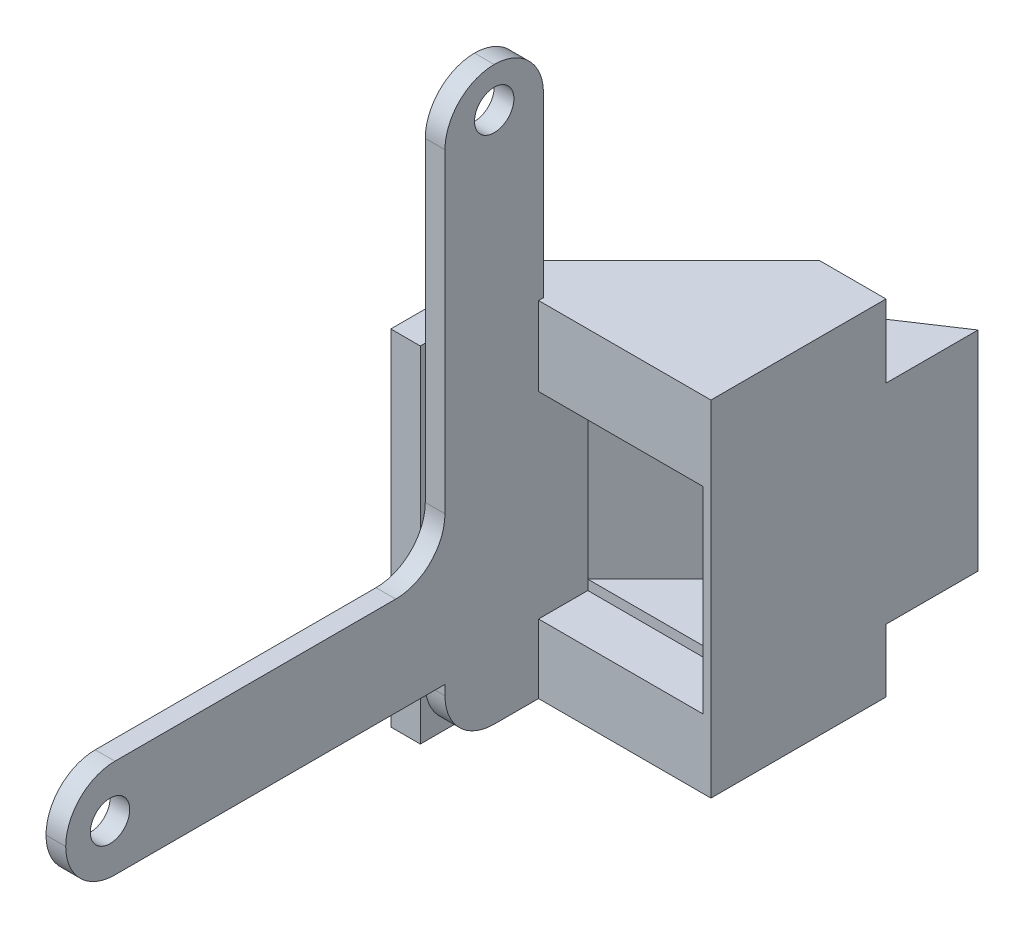
from build123d import *

# Parameters (mm, degrees)
SKETCH_1_W               = 2
SKETCH_1_H               = 58
EXTRUDE_1_DEPTH          = 53
SKETCH_4_W               = 5
SKETCH_4_H               = 35
EXTRUDE_3_DEPTH          = 19.5
CUT_EXTRUDE_START        = -0.8
SKETCH_9_W               = 5
SKETCH_9_H               = 20
CUT_EXTRUDE_5_DEPTH      = 16.7
SKETCH_10_R              = 2
CUT_EXTRUDE_6_DEPTH      = 10
SKETCH_11_W              = 38.5
SKETCH_11_H              = 6
SKETCH_11_H_2            = 42
SKETCH_11_W_2            = 4.5
SKETCH_11_H_3            = 23
CUT_EXTRUDE_7_DEPTH      = 10
FILLET_1_R               = 5
EXTRUDE_4_DEPTH          = 35
EXTRUDE_5_DEPTH          = 35
CUT_EXTRUDE_START_2      = 5
SKETCH_14_W              = 17.67500243
SKETCH_14_H              = 173.36044852
CUT_EXTRUDE_9_DEPTH      = 12
CUT_EXTRUDE_START_3      = 19
CUT_EXTRUDE_10_DEPTH     = 18
SKETCH_16_W              = 19.32347426
SKETCH_16_H              = 7.4
SKETCH_16_W_2            = 22.441906264
SKETCH_16_H_2            = 6.4
CUT_EXTRUDE_11_DEPTH     = 10
CUT_EXTRUDE_8_DEPTH      = 20
CUT_EXTRUDE_8_DEPTH_BACK = 43


with BuildPart() as part:
    # Эскиз1 → Бобышка-Вытянуть1 (new body)
    with BuildSketch(Plane.XY):
        with Locations((1, -29)):
            Rectangle(SKETCH_1_W, SKETCH_1_H)
    extrude(amount=EXTRUDE_1_DEPTH)

    # Эскиз4 → Бобышка-Вытянуть3 (add)
    with BuildSketch(Plane.ZY):
        with Locations((2.5, -40.5)):
            Rectangle(SKETCH_4_W, SKETCH_4_H)
    extrude(amount=-EXTRUDE_3_DEPTH)

    # Эскиз9 → Вырез-Вытянуть5 (cut)
    with BuildSketch(Plane(origin=(19.5, 0, 0), x_dir=(0, 0, -1), z_dir=(1, 0, 0)).offset(CUT_EXTRUDE_START)):
        with Locations((-2.5, -41)):
            Rectangle(SKETCH_9_W, SKETCH_9_H)
    extrude(amount=-CUT_EXTRUDE_5_DEPTH, mode=Mode.SUBTRACT)

    # Эскиз10 → Вырез-Вытянуть6 (cut)
    with BuildSketch(Plane(origin=(2, 0, 0), x_dir=(0, 0, -1), z_dir=(1, 0, 0))):
        with Locations(Location((-48.5, -47, 0), (0, 0, 90))):
            Circle(SKETCH_10_R)
        with Locations(Location((-9.5, -4, 0), (0, 0, 90))):
            Circle(SKETCH_10_R)
    extrude(amount=-CUT_EXTRUDE_6_DEPTH, mode=Mode.SUBTRACT)

    # Эскиз11 → Вырез-Вытянуть7 (cut)
    with BuildSketch(Plane(origin=(2, 0, 0), x_dir=(0, 0, -1), z_dir=(1, 0, 0))):
        with Locations((-33.75, -55)):
            Rectangle(SKETCH_11_W, SKETCH_11_H)
        with Locations((-33.75, -21)):
            Rectangle(SKETCH_11_W, SKETCH_11_H_2)
        with Locations((-2.25, -11.5)):
            Rectangle(SKETCH_11_W_2, SKETCH_11_H_3)
    extrude(amount=-CUT_EXTRUDE_7_DEPTH, mode=Mode.SUBTRACT)

    # Скругление1
    fillet_1_edges = [part.edges().sort_by_distance(p)[0] for p in [
        (1, -42, 14.5),
        (1, 0, 4.5),
        (1, 0, 14.5),
        (1, -58, 14.5),
        (1, -42, 53),
        (1, -52, 53),
    ]]
    fillet(fillet_1_edges, radius=FILLET_1_R - 0.0001)  # a hair under: the kernel refuses the full size

    # Эскиз12 → Бобышка-Вытянуть4 (add)
    with BuildSketch(Plane.XZ.offset(58)):
        Polygon((0, 0), (0, 15), (-15, 15), align=None)
    extrude(amount=-EXTRUDE_4_DEPTH)

    # Эскиз13 → Бобышка-Вытянуть5 (add)
    with BuildSketch(Plane(origin=(0, -23, 0), x_dir=(1, 0, 0), z_dir=(0, 1, 0))):
        Polygon((0, 0), (19.5, 0), (19.5, 22.111293257), (12.772431149, 17.644276295), (12.772431149, 12.772431149), align=None)
    extrude(amount=-EXTRUDE_5_DEPTH)

    # Эскиз14 → Вырез-Вытянуть9 (cut)
    with BuildSketch(Plane.ZY.offset(-2).offset(CUT_EXTRUDE_START_2)):
        with Locations((6.192960349, -52.7238676)):
            Rectangle(SKETCH_14_W, SKETCH_14_H)
    extrude(amount=CUT_EXTRUDE_9_DEPTH, mode=Mode.SUBTRACT)

    # Эскиз15 → Вырез-Вытянуть10 (cut)
    with BuildSketch(Plane.XZ.offset(31).offset(CUT_EXTRUDE_START_3)):
        Polygon((18.1, 0), (14.172431149, 0), (14.172431149, -12.192532161), (14.172431149, -24.03140998), (18.1, -24.03140998), align=None)
        Polygon((14.172431149, -12.192532161), (14.172431149, 0), (2, 0), (1.979898987, 0), align=None)
    extrude(amount=-CUT_EXTRUDE_10_DEPTH, mode=Mode.SUBTRACT)

    # Эскиз16 → Вырез-Вытянуть11 (cut)
    with BuildSketch(Plane.ZY.offset(-12.772431149)):
        with Locations((-22.434168279, -26.7)):
            Rectangle(SKETCH_16_W, SKETCH_16_H)
        with Locations((-23.993384281, -54.8)):
            Rectangle(SKETCH_16_W_2, SKETCH_16_H_2)
    extrude(amount=-CUT_EXTRUDE_11_DEPTH, mode=Mode.SUBTRACT)

    # Эскиз8 → Вырез-Вытянуть8 (cut, two sides: drawn at the far end of the back side and taken through both)
    with BuildSketch(Plane(origin=(0, 0, 0), x_dir=(-0.7071067811865437, 0, -0.7071067811865515), z_dir=(0.7071067811865515, 0, -0.7071067811865437)).offset(-CUT_EXTRUDE_8_DEPTH_BACK)):
        with BuildLine():
            Line((-2, -29.25), (0, -29.25))
            Line((0, -29.25), (0, -27.75))
            Line((0, -27.75), (-1.133974596, -27.75))
            Line((-1.133974596, -27.75), (-1.700961894, -26.767949192))
            ThreePointArc((-1.700961894, -26.767949192), (-1.626036577, -26.948834909), (-1.600480947, -27.142949192))
            ThreePointArc((-1.600480947, -27.142949192), (-2.156366663, -27.867393562), (-3, -27.517949192))
            Line((-3, -27.517949192), (-2, -29.25))
        make_face()
        with BuildLine():
            ThreePointArc((-1.700961894, -26.767949192), (-2.725480947, -26.49343014), (-3, -27.517949192))
            Line((-3, -27.517949192), (-1.700961894, -26.767949192))
        make_face()
        with BuildLine():
            Line((-1.700961894, -26.767949192), (-3, -27.517949192))
            ThreePointArc((-3, -27.517949192), (-2.156366663, -27.867393562), (-1.600480947, -27.142949192))
            ThreePointArc((-1.600480947, -27.142949192), (-1.626036577, -26.948834909), (-1.700961894, -26.767949192))
        make_face()
        with BuildLine():
            ThreePointArc((-3, -53.482050808), (-2.725480947, -54.50656986), (-1.700961894, -54.232050808))
            Line((-1.700961894, -54.232050808), (-3, -53.482050808))
        make_face()
        with BuildLine():
            Line((-3, -53.482050808), (-1.700961894, -54.232050808))
            ThreePointArc((-1.700961894, -54.232050808), (-1.626036577, -54.051165091), (-1.600480947, -53.857050808))
            ThreePointArc((-1.600480947, -53.857050808), (-2.156366663, -53.132606438), (-3, -53.482050808))
        make_face()
        with BuildLine():
            Line((-1.133974596, -53.25), (0, -53.25))
            Line((0, -53.25), (0, -51.75))
            Line((0, -51.75), (-2, -51.75))
            Line((-2, -51.75), (-3, -53.482050808))
            ThreePointArc((-3, -53.482050808), (-2.156366663, -53.132606438), (-1.600480947, -53.857050808))
            ThreePointArc((-1.600480947, -53.857050808), (-1.626036577, -54.051165091), (-1.700961894, -54.232050808))
            Line((-1.700961894, -54.232050808), (-1.133974596, -53.25))
        make_face()
    extrude(amount=CUT_EXTRUDE_8_DEPTH + CUT_EXTRUDE_8_DEPTH_BACK, mode=Mode.SUBTRACT)


solid = part.part
